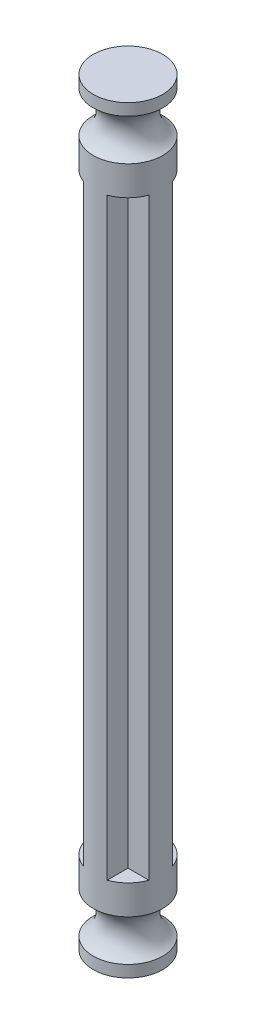
from build123d import *
from build123d.topology import SkipClean

# Parameters (mm, degrees)
EXTRUDE_2_DEPTH = 50.42


with BuildPart() as part:
    # 草图1 → 凸台-拉伸2 (new body)
    with BuildSketch(Plane(origin=(0, 0, 0), x_dir=(1, 0, 0), z_dir=(0, 1, 0))):
        with BuildLine():
            Line((1, 1), (1, 2.775337817))
            ThreePointArc((1, 2.775337817), (0, 2.95), (-1, 2.775337817))
            Line((-1, 2.775337817), (-1, 1))
            Line((-1, 1), (-2.775337817, 1))
            ThreePointArc((-2.775337817, 1), (-2.95, 0), (-2.775337817, -1))
            Line((-2.775337817, -1), (-1, -1))
            Line((-1, -1), (-1, -2.775337817))
            ThreePointArc((-1, -2.775337817), (0, -2.95), (1, -2.775337817))
            Line((1, -2.775337817), (1, -1))
            Line((1, -1), (2.775337817, -1))
            ThreePointArc((2.775337817, -1), (2.95, 0), (2.775337817, 1))
            Line((2.775337817, 1), (1, 1))
        make_face()
    extrude(amount=EXTRUDE_2_DEPTH)

    # 草图3 → 旋转3 (revolve)
    with SkipClean():  # the faces are left unmerged after this step: merging them gives an invalid solid
        with BuildSketch(Plane(origin=(0, 0, 0), x_dir=(0, 0, -1), z_dir=(1, 0, 0))):
            with BuildLine():
                Line((0, 50.42), (0, 57.42))
                Line((0, 57.42), (2.95, 57.42))
                Line((2.95, 57.42), (2.95, 56.42))
                ThreePointArc((2.95, 56.42), (1.918245837, 54.67), (2.95, 52.92))
                Line((2.95, 52.92), (2.95, 50.42))
                Line((2.95, 50.42), (0, 50.42))
            make_face()
            with BuildLine():
                Line((0, 0), (0, -7))
                Line((0, -7), (2.95, -7))
                Line((2.95, -7), (2.95, -6))
                ThreePointArc((2.95, -6), (1.918245837, -4.25), (2.95, -2.5))
                Line((2.95, -2.5), (2.95, 0))
                Line((2.95, 0), (0, 0))
            make_face()
        revolve(axis=Axis((0, 0, 0), (0, -1, 0)))


solid = part.part
